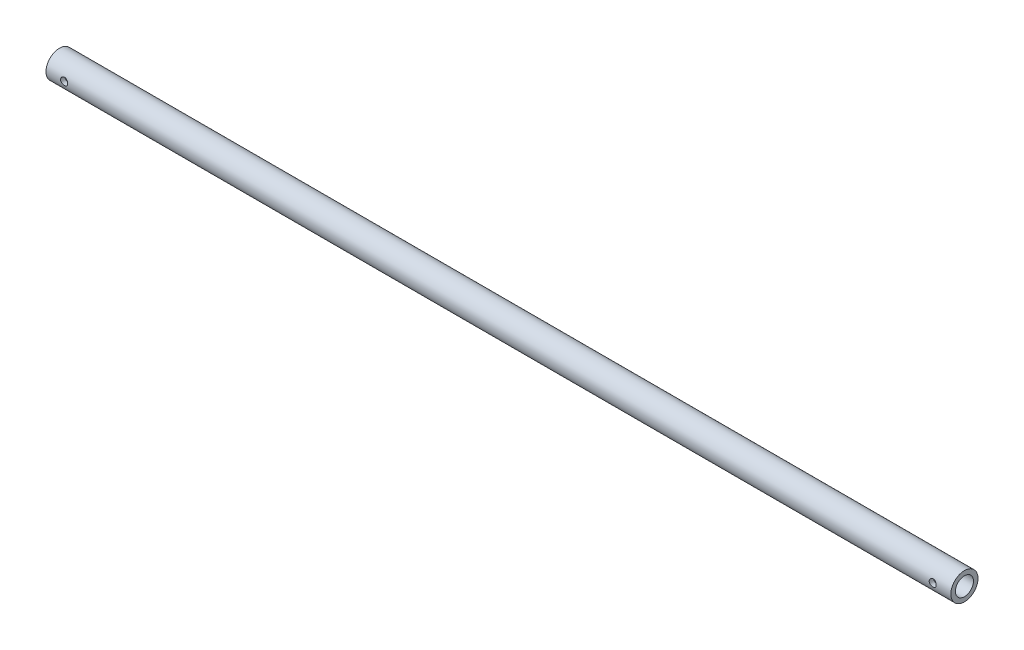
from build123d import *

# Parameters (mm, degrees)
SKETCH3_R           = 9.525
SKETCH3_R_2         = 6.35
BOSS_EXTRUDE1_DEPTH = 317.5
SKETCH6_R           = 2.4892
CUT_EXTRUDE1_DEPTH  = 319.429233056
SKETCH7_R           = 2.4892
CUT_EXTRUDE2_DEPTH  = 319.429233166


with BuildPart() as part:
    # Sketch3 → Boss-Extrude1 (new, symmetric)
    with BuildSketch(Plane(origin=(0, 0, 0), x_dir=(0, 0, -1), z_dir=(1, 0, 0))):
        Circle(SKETCH3_R)
        Circle(SKETCH3_R_2, mode=Mode.SUBTRACT)
    extrude(amount=BOSS_EXTRUDE1_DEPTH, both=True)

    # Sketch6 → Cut-Extrude1 (cut, through all)
    with BuildSketch(Plane(origin=(0, 0.332447244, 12.695648027), x_dir=(1, 0, 0), z_dir=(0, 0.026176948307995423, 0.9996573249755542))):
        with Locations((-304.8, 0)):
            Circle(SKETCH6_R)
    extrude(amount=-CUT_EXTRUDE1_DEPTH, mode=Mode.SUBTRACT)

    # Sketch7 → Cut-Extrude2 (cut, through all)
    with BuildSketch(Plane(origin=(0, 0.332447244, 12.695648027), x_dir=(1, 0, 0), z_dir=(0, 0.026176948307995423, 0.9996573249755542))):
        with Locations((304.740403866, 0)):
            Circle(SKETCH7_R)
    extrude(amount=-CUT_EXTRUDE2_DEPTH, mode=Mode.SUBTRACT)


solid = part.part
